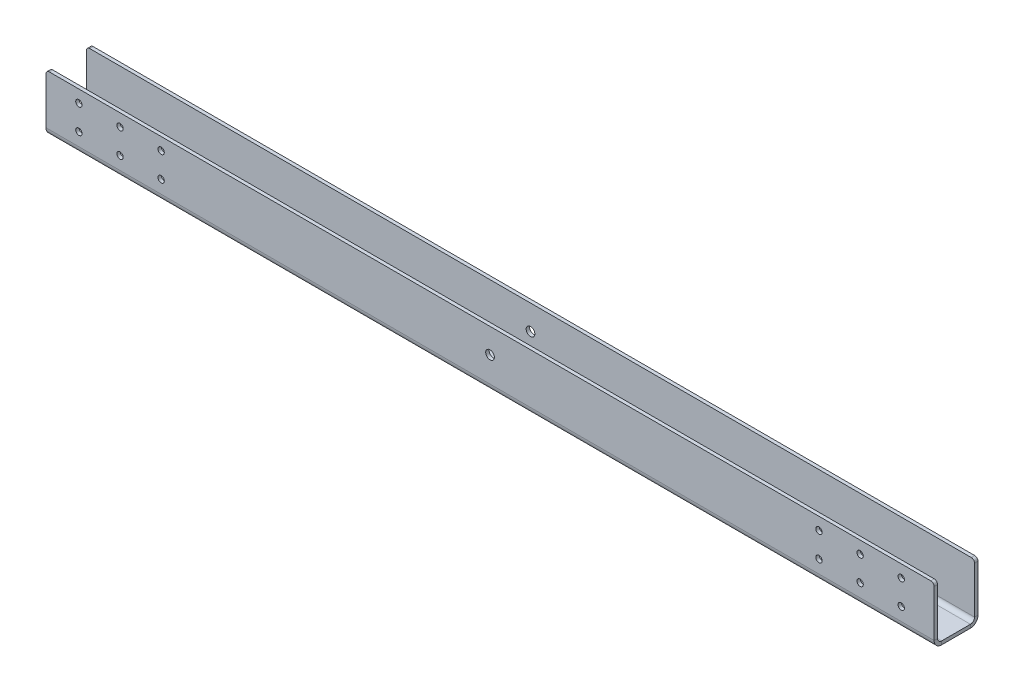
from build123d import *

# Parameters (mm, degrees)
SKETCH1_W                        = 685.8
SKETCH1_H                        = 22.225
BASE_FLANGE1_DEPTH               = 2.65684
EDGE_FLANGE1_DEPTH               = 685.8
EDGE_FLANGE2_DEPTH               = 685.8
F_17_64_0_26563_DIAMETER_HOLE1_D = 6.747002
F_10_0_1935_DIAMETER_HOLE1_D     = 4.9149
F_10_0_1935_DIAMETER_HOLE1_DEPTH = 2.65684
FILLET1_R                        = 2.54


# Sheet-metal steps are written as plain solids
with BuildPart() as part:
    # Sketch1 → Base-Flange1 (new body)
    with BuildSketch(Plane(origin=(0, 0, 0), x_dir=(1, 0, 0), z_dir=(0, 1, 0))):
        with Locations((342.9, 11.1125)):
            Rectangle(SKETCH1_W, SKETCH1_H)
    extrude(amount=-BASE_FLANGE1_DEPTH)

    # Edge-Flange1 section (across the edge) → Edge-Flange1 (add)
    with BuildSketch(Plane(origin=(0, 0, 3.175), x_dir=(0, 0, -1), z_dir=(1, 0, 0))):
        with BuildLine():
            Line((-2.65684, 3.175), (-2.65684, 41.79316))
            Line((-2.65684, 41.79316), (0, 41.79316))
            Line((0, 41.79316), (0, 3.175))
            ThreePointArc((0, 3.175), (0.92993597, 0.92993597), (3.175, 0))
            Line((3.175, 0), (3.175, -2.65684))
            ThreePointArc((3.175, -2.65684), (-0.948733611, -0.948733611), (-2.65684, 3.175))
        make_face()
    extrude(amount=EDGE_FLANGE1_DEPTH)

    # Edge-Flange2 section (across the edge) → Edge-Flange2 (add)
    with BuildSketch(Plane(origin=(685.8, 0, -25.4), x_dir=(0, 0, 1), z_dir=(-1, 0, 0))):
        with BuildLine():
            Line((-2.65684, 3.175), (-2.65684, 41.79316))
            Line((-2.65684, 41.79316), (0, 41.79316))
            Line((0, 41.79316), (0, 3.175))
            ThreePointArc((0, 3.175), (0.92993597, 0.92993597), (3.175, 0))
            Line((3.175, 0), (3.175, -2.65684))
            ThreePointArc((3.175, -2.65684), (-0.948733611, -0.948733611), (-2.65684, 3.175))
        make_face()
    extrude(amount=EDGE_FLANGE2_DEPTH)

    # 17/64 (0.26563) Diameter Hole1 (through all)
    with Locations(Plane(origin=(0, 0, -28.05684), x_dir=(-1, 0, 0), z_dir=(0, 0, -1))):
        with Locations((-342.9, 22.74316)):
            Hole(F_17_64_0_26563_DIAMETER_HOLE1_D / 2)

    # #10 (0.1935) Diameter Hole1
    with Locations(Plane.XY.offset(5.83184)):
        with Locations((596.9, 13.21816), (596.9, 32.26816), (628.65, 32.26816), (628.65, 13.21816), (660.4, 13.21816), (660.4, 32.26816), (88.9, 13.21816), (88.9, 32.26816), (57.15, 13.21816), (57.15, 32.26816), (25.4, 13.21816), (25.4, 32.26816)):
            Hole(F_10_0_1935_DIAMETER_HOLE1_D / 2, depth=F_10_0_1935_DIAMETER_HOLE1_DEPTH)

    # Fillet1
    fillet1_edges = [part.edges().sort_by_distance(p)[0] for p in [
        (0, 41.79316, 4.50342),
        (685.8, 41.79316, 4.50342),
        (685.8, 41.79316, -26.72842),
        (0, 41.79316, -26.72842),
    ]]
    fillet(fillet1_edges, radius=FILLET1_R)


solid = part.part
